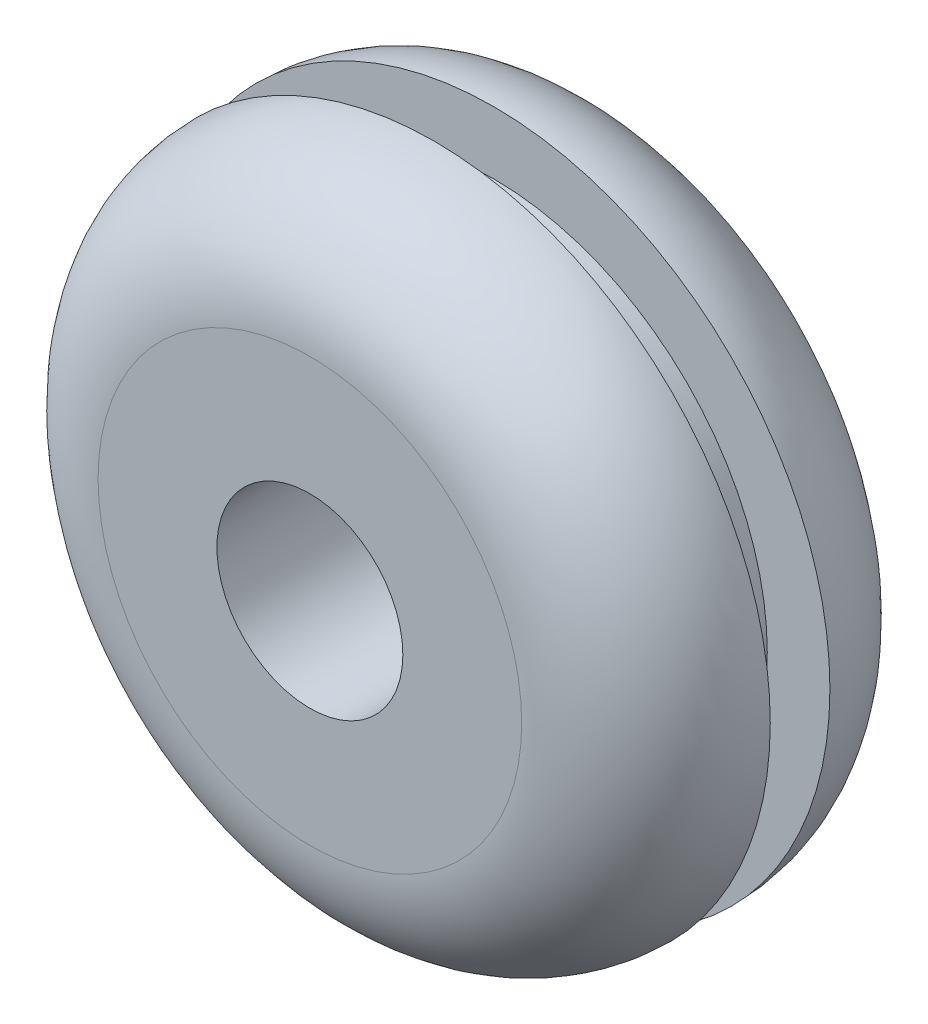
from build123d import *

# Parameters (mm, degrees)
SKETCH3_R            = 6.985
BASE_EXTRUDE_DEPTH   = 0.762
SKETCH4_R            = 8.5852
BOSS_EXTRUDE2_DEPTH  = 3.175
FILLET1_R            = 3.175
FILLET1_OF_MIRROR1_R = 3.175
SKETCH5_R            = 2.3749
CUT_EXTRUDE1_DEPTH   = 15.47104687


with BuildPart() as part:
    # Sketch3 → Base-Extrude (new, symmetric)
    with BuildSketch(Plane.XY):
        with Locations(Location((0, 0, 0), (0, 0, 180))):
            Circle(SKETCH3_R)
    extrude(amount=BASE_EXTRUDE_DEPTH, both=True)

    # Sketch4 → Boss-Extrude2 (add)
    with BuildSketch(Plane.XY.offset(0.762)):
        Circle(SKETCH4_R)
    boss_extrude2 = extrude(amount=BOSS_EXTRUDE2_DEPTH)

    # Fillet1
    fillet1_edges = [part.edges().sort_by_distance(p)[0] for p in [
        (-8.5852, 0, 3.937),
    ]]
    fillet(fillet1_edges, radius=FILLET1_R - 0.0001)  # a hair under: the kernel refuses the full size

    # Mirror1: Boss-Extrude2 across plane
    add(boss_extrude2.mirror(Plane.XY))

    # Fillet1 of Mirror1
    fillet1_of_mirror1_edges = [part.edges().sort_by_distance(p)[0] for p in [
        (-8.5852, 0, -3.937),
    ]]
    fillet(fillet1_of_mirror1_edges, radius=FILLET1_OF_MIRROR1_R - 0.0001)  # a hair under: the kernel refuses the full size

    # Sketch5 → Cut-Extrude1 (cut, through all)
    with BuildSketch(Plane.XY.offset(3.937)):
        Circle(SKETCH5_R)
    extrude(amount=-CUT_EXTRUDE1_DEPTH, mode=Mode.SUBTRACT)


solid = part.part
